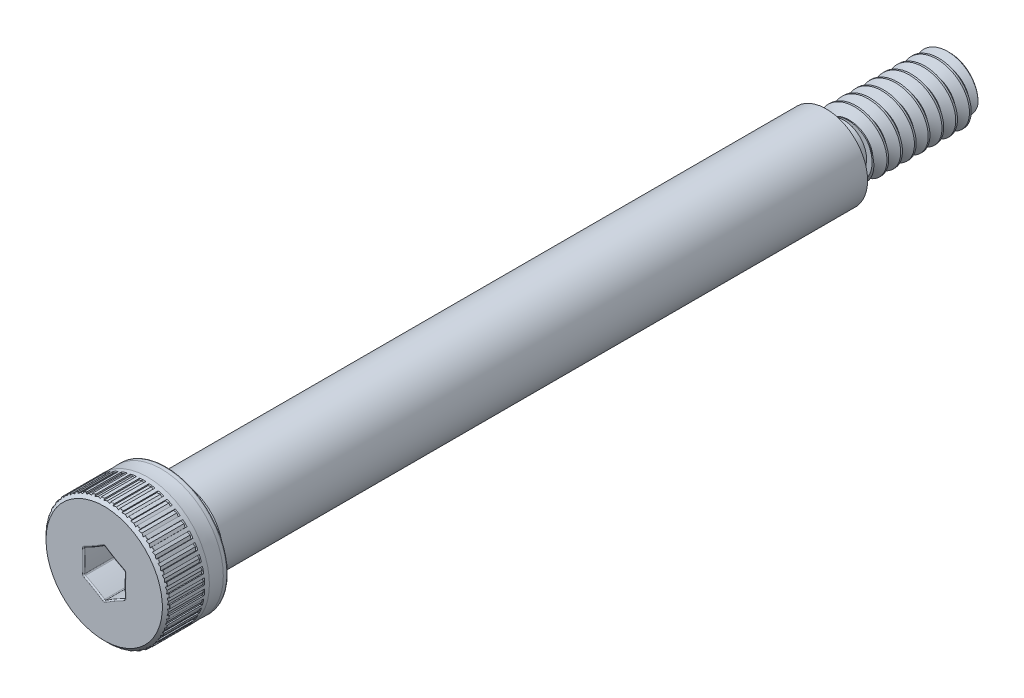
from build123d import *

# Parameters (mm, degrees)
SKETCH4_W             = 1.190625
SKETCH4_H             = 0.3175
SKETCH4_W_2           = 1.375833333
SKETCH4_H_2           = 0.687407664
CHAMFER1_SIZE         = 0.3175
FILLET1_R             = 0.1905
FILLET2_R             = 0.211666667
CHAMFER2_SIZE         = 0.264583333
CHAMFER3_SIZE         = 0.28575
CUT_EXTRUDE1_DEPTH    = 2.413
FILLET4_R             = 0.09525
DELETEFACE1_START     = -52.175833333
DELETEFACE1_OUTLINE_W = 6
DELETEFACE1_OUTLINE_H = 6
DELETEFACE1_OUTLINE_R = 1.725592336
DELETEFACE1_DEPTH     = 0.211666766
CUT_SWEEP1_PITCH      = 1.058333333
CUT_EXTRUDE2_REACH    = 67.435
CIRPATTERN1_COUNT     = 42
FILLET5_R             = 0.0508


# Read off the part's stored shape, not the designer's step: DeleteFace1, CirPattern2
with BuildPart() as part:
    # Sketch3 → Revolve1 (revolve)
    with BuildSketch(Plane(origin=(0, 0, 0), x_dir=(0, 0, -1), z_dir=(1, 0, 0)), mode=Mode.PRIVATE) as revolve1_sk:
        Polygon((-4.7625, 4.7625), (0, 4.7625), (0, 3.175), (50.8, 3.175), (50.8, 2.413), (60.325, 2.413), (60.325, 0), (-4.7625, 0), align=None)
    revolve(revolve1_sk.sketch.rotate(Axis((0, 0, 4.7625), (0, 0, -1)), 90), axis=Axis((0, 0, 4.7625), (0, 0, -1)))

    # Sketch4 → Cut-Revolve1 (revolve, cut)
    with BuildSketch(Plane(origin=(0, 0, 0), x_dir=(0, 0, -1), z_dir=(1, 0, 0)), mode=Mode.PRIVATE) as cut_revolve1_sk:
        with Locations((0.5953125, 3.01625)):
            Rectangle(SKETCH4_W, SKETCH4_H)
        with Locations((51.487916666, 2.069296168)):
            Rectangle(SKETCH4_W_2, SKETCH4_H_2)
    revolve(cut_revolve1_sk.sketch.rotate(Axis((0, 0, 4.7625), (0, 0, -1)), 90), axis=Axis((0, 0, 4.7625), (0, 0, -1)), mode=Mode.SUBTRACT)

    # Chamfer1
    chamfer1_edges = [part.edges().sort_by_distance(p)[0] for p in [
        (-2.8575, 0, -1.190625),
    ]]
    chamfer(chamfer1_edges, length=CHAMFER1_SIZE - 0.0001)  # a hair under: the kernel refuses the full size

    # Fillet1
    fillet1_edges = [part.edges().sort_by_distance(p)[0] for p in [
        (-2.8575, 0, 0),
    ]]
    fillet(fillet1_edges, radius=FILLET1_R)

    # Fillet2
    fillet2_edges = [part.edges().sort_by_distance(p)[0] for p in [
        (-1.725592336, 0, -50.8),
        (-1.725592336, 0, -52.175833333),
    ]]
    fillet(fillet2_edges, radius=FILLET2_R)

    # Chamfer2
    chamfer2_edges = [part.edges().sort_by_distance(p)[0] for p in [
        (-2.413, 0, -52.175833333),
        (-2.413, 0, -60.325),
    ]]
    chamfer(chamfer2_edges, length=CHAMFER2_SIZE)

    # Chamfer3
    chamfer3_edges = [part.edges().sort_by_distance(p)[0] for p in [
        (-4.7625, 0, 4.7625),
    ]]
    chamfer(chamfer3_edges, length=CHAMFER3_SIZE)

    # Sketch5 → Cut-Extrude1 (cut)
    with BuildSketch(Plane.XY.offset(4.7625)):
        with BuildLine():
            ThreePointArc((1.5875, 0.916543552), (0.777875, 1.347319022), (0, 1.833087105))
            ThreePointArc((0, 1.833087105), (-0.777875, 1.347319022), (-1.5875, 0.916543552))
            ThreePointArc((-1.5875, 0.916543552), (-1.55575, 0), (-1.5875, -0.916543552))
            ThreePointArc((-1.5875, -0.916543552), (-0.777875, -1.347319022), (0, -1.833087105))
            ThreePointArc((0, -1.833087105), (0.777875, -1.347319022), (1.5875, -0.916543552))
            ThreePointArc((1.5875, -0.916543552), (1.55575, 0), (1.5875, 0.916543552))
        make_face()
    extrude(amount=-CUT_EXTRUDE1_DEPTH, mode=Mode.SUBTRACT)

    # Fillet4
    fillet4_edges = [part.edges().sort_by_distance(p)[0] for p in [
        (1.55575, 0, 2.3495),
        (1.5875, 0.916543552, 3.556),
        (0.777875, -1.347319022, 2.3495),
        (1.5875, -0.916543552, 3.556),
        (-0.777875, -1.347319022, 2.3495),
        (0, -1.833087105, 3.556),
        (-1.55575, 0, 2.3495),
        (-1.5875, -0.916543552, 3.556),
        (-0.777875, 1.347319022, 2.3495),
        (-1.5875, 0.916543552, 3.556),
        (0.777875, 1.347319022, 2.3495),
        (0, 1.833087105, 3.556),
        (1.55575, 0, 4.7625),
        (0.777875, 1.347319022, 4.7625),
        (-0.777875, 1.347319022, 4.7625),
        (-1.55575, 0, 4.7625),
        (-0.777875, -1.347319022, 4.7625),
        (0.777875, -1.347319022, 4.7625),
        (-4.7625, 0, 0),
    ]]
    fillet(fillet4_edges, radius=FILLET4_R)

    # DeleteFace1 outline → DeleteFace1 (cut)
    with BuildSketch(Plane.XY.offset(DELETEFACE1_START)):
        Rectangle(DELETEFACE1_OUTLINE_W, DELETEFACE1_OUTLINE_H)
        Circle(DELETEFACE1_OUTLINE_R, mode=Mode.SUBTRACT)
    extrude(amount=DELETEFACE1_DEPTH, mode=Mode.SUBTRACT)

    # Cut-Sweep1: the profile of Sketch7 profile screwed along a right-hand helix of 8.48 turns, 8 arcs to a turn; built about Z, then put on its axis
    cut_sweep1_z = Axis((0, 0, 0), (0, 0, 1))
    cut_sweep1_corners = [(2.470283972, 0, 0.033072917), (2.470283972, 0, -0.959114583), (1.725292336, 0, -0.528993462), (1.725292336, 0, -0.397048205)]
    with BuildLine(mode=Mode.PRIVATE) as cut_sweep1_profile:
        Line(cut_sweep1_corners[0], cut_sweep1_corners[1])
        Line(cut_sweep1_corners[1], cut_sweep1_corners[2])
        Line(cut_sweep1_corners[2], cut_sweep1_corners[3])
        Line(cut_sweep1_corners[3], cut_sweep1_corners[0])
    cut_sweep1_cap = Face(cut_sweep1_profile.wire())
    cut_sweep1_turn_angles = [0, 22.5, 45, 67.5, 90, 112.5, 135, 157.5, 180, 202.5, 225, 247.5, 270, 292.5, 315, 337.5, 360]
    cut_sweep1_turn_weights = [1, 0.9238795325112867, 1, 0.9238795325112867, 1, 0.9238795325112867, 1, 0.9238795325112867, 1, 0.9238795325112867, 1, 0.9238795325112867, 1, 0.9238795325112867, 1, 0.9238795325112867, 1]
    cut_sweep1_turn_rails = [Edge.make_bspline([Vector(p[0], p[1], 0).rotate(cut_sweep1_z, cut_sweep1_turn_angles[k]) / cut_sweep1_turn_weights[k] + Vector(0, 0, p[2] + CUT_SWEEP1_PITCH * cut_sweep1_turn_angles[k] / 360) for k in range(17)], [0, 0, 0, 1, 1, 2, 2, 3, 3, 4, 4, 5, 5, 6, 6, 7, 7, 8, 8, 8], 2, cut_sweep1_turn_weights) for p in cut_sweep1_corners]
    cut_sweep1_turn_sides = [Face.make_surface_from_curves(cut_sweep1_turn_rails[p[0]], cut_sweep1_turn_rails[p[1]]) for p in [(0, 1), (1, 2), (2, 3), (3, 0)]]
    cut_sweep1_last_angles = [2880, 2902.5, 2925, 2947.5, 2970, 2992.5, 3015, 3033.9, 3052.8]
    cut_sweep1_last_weights = [1, 0.9238795325112867, 1, 0.9238795325112867, 1, 0.9238795325112867, 1, 0.9460853588275975, 1]
    cut_sweep1_last_rails = [Edge.make_bspline([Vector(p[0], p[1], 0).rotate(cut_sweep1_z, cut_sweep1_last_angles[k]) / cut_sweep1_last_weights[k] + Vector(0, 0, p[2] + CUT_SWEEP1_PITCH * cut_sweep1_last_angles[k] / 360) for k in range(9)], [0, 0, 0, 1, 1, 2, 2, 3, 3, 4, 4, 4], 2, cut_sweep1_last_weights) for p in cut_sweep1_corners]
    cut_sweep1_last_sides = [Face.make_surface_from_curves(cut_sweep1_last_rails[p[0]], cut_sweep1_last_rails[p[1]]) for p in [(0, 1), (1, 2), (2, 3), (3, 0)]]
    cut_sweep1 = Plane(origin=(0, 0, -60.325), x_dir=(0, 1, 0), z_dir=(0, 0, 1)) * Solid(Shell([*[p.moved(Location((0, 0, CUT_SWEEP1_PITCH * i))) for i in range(8) for p in cut_sweep1_turn_sides], *cut_sweep1_last_sides, cut_sweep1_cap, cut_sweep1_cap.rotate(cut_sweep1_z, 3052.8).moved(Location((0, 0, CUT_SWEEP1_PITCH * 3052.8 / 360)))]))
    add(cut_sweep1, mode=Mode.SUBTRACT)

    # Cut-Extrude2: up to this plane
    cut_extrude2_end = Plane(origin=(0, 5.814873764, 0.733563736), z_dir=(0, 0.707106781186546, 0.7071067811865491))
    # Sketch8 → Cut-Extrude2 (cut, up to the surface)
    with BuildSketch(Plane.XY.offset(4.7625), mode=Mode.PRIVATE) as cut_extrude2_sk1:
        Polygon((-0.2286, 4.7625), (0.2286, 4.7625), (0.218989269, 4.67106), (0, 4.71678), (-0.218989269, 4.67106), align=None)
    cut_extrude2_tool1 = split(extrude(cut_extrude2_sk1.sketch, amount=-CUT_EXTRUDE2_REACH, mode=Mode.PRIVATE), bisect_by=cut_extrude2_end, keep=Keep.BOTH, mode=Mode.PRIVATE)
    cut_extrude2 = cut_extrude2_tool1.solids().sort_by_distance((0, 4.727084, 4.7625))[0]
    add(cut_extrude2, mode=Mode.SUBTRACT)

    # CirPattern1: Cut-Extrude2 ×42 about axis
    cirpattern1_axis = Axis((0, 0, 0), (0, 0, 1))
    for i in range(1, CIRPATTERN1_COUNT):
        add(cut_extrude2.rotate(cirpattern1_axis, i * 360 / CIRPATTERN1_COUNT), mode=Mode.SUBTRACT)

    # Fillet5
    fillet5_edges = [part.edges().sort_by_distance(p)[0] for p in [
        (0.355902071, 4.749183084, 4.47675),
    ]]
    fillet(fillet5_edges, radius=FILLET5_R)

    # CirPattern2 outline → CirPattern2 (revolve, cut)
    with BuildSketch(Plane.XZ):
        with BuildLine():
            ThreePointArc((4.747621024, 4.491628976), (4.75863308, 4.47514827), (4.7625, 4.455707951))
            Line((4.7625, 4.455707951), (4.7625, 4.491628976))
            Line((4.7625, 4.491628976), (4.747621024, 4.491628976))
        make_face()
    revolve(axis=Axis((0, 0, 0), (0, 0, 1)), mode=Mode.SUBTRACT)

    # Sketch11 → Cut-Revolve6 (revolve, cut)
    with BuildSketch(Plane(origin=(0, 0, 0), x_dir=(0, 0, -1), z_dir=(1, 0, 0)), mode=Mode.PRIVATE) as cut_revolve6_sk:
        with BuildLine():
            Line((-1.42875, 4.7625), (-0.3571875, 4.7625))
            ThreePointArc((-0.3571875, 4.7625), (-0.89296875, 4.74472), (-1.42875, 4.7625))
        make_face()
    revolve(cut_revolve6_sk.sketch.rotate(Axis((0, 0, 4.7625), (0, 0, -1)), 90), axis=Axis((0, 0, 4.7625), (0, 0, -1)), mode=Mode.SUBTRACT)


solid = part.part
